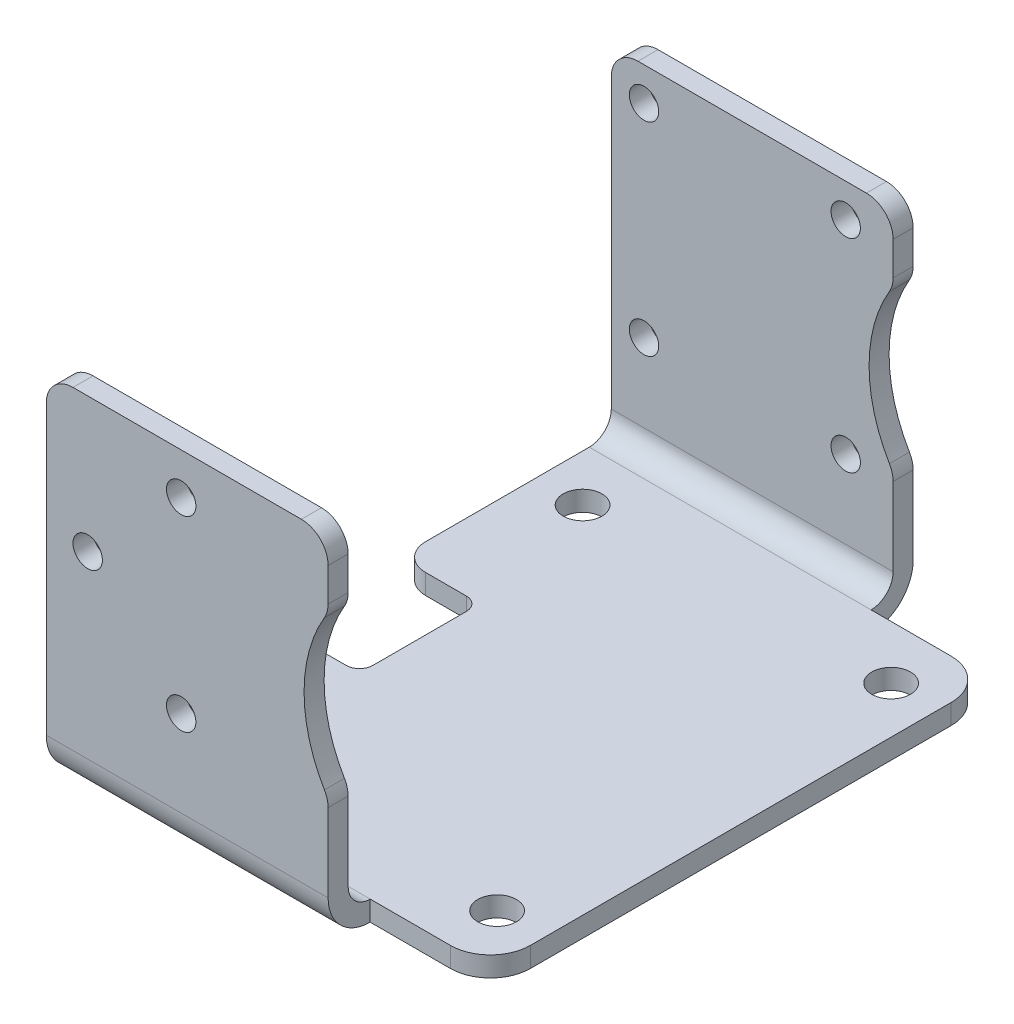
from build123d import *

# Parameters (mm, degrees)
SKETCH1_W                      = 40.1
SKETCH1_H                      = 40.8
BASE_FLANGE1_DEPTH             = 1.5
EDGE_FLANGE2_STRIP_W           = 9.3
EDGE_FLANGE2_STRIP_H           = 1.5
EDGE_FLANGE2_STRIP_CUT_DEPTH   = 40.1
EDGE_FLANGE2_STRIP_2_W         = 9.3
EDGE_FLANGE2_STRIP_2_H         = 1.5
EDGE_FLANGE2_STRIP_CUT_2_DEPTH = 40.1
EDGE_FLANGE2_DEPTH             = 40.1
EDGE_FLANGE2_BEND_DEPTH        = 40.1
SKETCH23_W                     = 3.15
SKETCH23_H                     = 26.7
CUT_EXTRUDE3_DEPTH             = 19
SKETCH24_R                     = 11
CUT_EXTRUDE4_DEPTH             = 55.364349532
SKETCH26_W                     = 10
SKETCH26_H                     = 37.5
CUT_EXTRUDE5_DEPTH             = 39.944222935
SKETCH27_R                     = 1.45
CUT_EXTRUDE6_DEPTH             = 39.944222935
FILLET1_R                      = 3
FILLET2_R                      = 2
F_2_0MM_DOWEL_HOLE1_D          = 2.2
F_2_0MM_DOWEL_HOLE1_DEPTH      = 1.5
F_2_0MM_DOWEL_HOLE2_D          = 2.2
F_2_0MM_DOWEL_HOLE2_DEPTH      = 1.5
CUT_EXTRUDE7_DEPTH             = 40.93122212
FILLET3_R                      = 2


# Sheet-metal steps are written as plain solids
with BuildPart() as part:
    # Sketch1 → Base-Flange1 (new body)
    with BuildSketch(Plane(origin=(0, 0, 0), x_dir=(1, 0, 0), z_dir=(0, 1, 0))):
        Rectangle(SKETCH1_W, SKETCH1_H)
    extrude(amount=-BASE_FLANGE1_DEPTH)

    # Edge-Flange2 strip (across the edge) → Edge-Flange2 strip cut (cut)
    with BuildSketch(Plane(origin=(-20.05, 0, 20.4), x_dir=(0, 0, -1), z_dir=(1, 0, 0))):
        with Locations((-3, -0.75)):
            Rectangle(EDGE_FLANGE2_STRIP_W, EDGE_FLANGE2_STRIP_H)
    extrude(amount=EDGE_FLANGE2_STRIP_CUT_DEPTH, mode=Mode.SUBTRACT)

    # Edge-Flange2 strip 2 (across the edge) → Edge-Flange2 strip cut 2 (cut)
    with BuildSketch(Plane(origin=(20.05, 0, -20.4), x_dir=(0, 0, 1), z_dir=(-1, 0, 0))):
        with Locations((-3, -0.75)):
            Rectangle(EDGE_FLANGE2_STRIP_2_W, EDGE_FLANGE2_STRIP_2_H)
    extrude(amount=EDGE_FLANGE2_STRIP_CUT_2_DEPTH, mode=Mode.SUBTRACT)

    # Edge-Flange2 section (across the edge) → Edge-Flange2 (add)
    with BuildSketch(Plane(origin=(-20.05, 0, 20.4), x_dir=(0, 0, -1), z_dir=(1, 0, 0))):
        with BuildLine():
            Line((-1.5, 1.65), (-1.5, 25.2))
            Line((-1.5, 25.2), (0, 25.2))
            Line((0, 25.2), (0, 1.65))
            ThreePointArc((0, 1.65), (0.483273811, 0.483273811), (1.65, 0))
            Line((1.65, 0), (1.65, -1.5))
            ThreePointArc((1.65, -1.5), (-0.577386361, -0.577386361), (-1.5, 1.65))
        make_face()
    extrude(amount=EDGE_FLANGE2_DEPTH)

    # Edge-Flange2 section 2 (across the edge) → Edge-Flange2 bend (add)
    with BuildSketch(Plane(origin=(20.05, 0, -20.4), x_dir=(0, 0, 1), z_dir=(-1, 0, 0))):
        with BuildLine():
            Line((-1.5, 1.65), (-1.5, 25.2))
            Line((-1.5, 25.2), (0, 25.2))
            Line((0, 25.2), (0, 1.65))
            ThreePointArc((0, 1.65), (0.483273811, 0.483273811), (1.65, 0))
            Line((1.65, 0), (1.65, -1.5))
            ThreePointArc((1.65, -1.5), (-0.577386361, -0.577386361), (-1.5, 1.65))
        make_face()
    extrude(amount=EDGE_FLANGE2_BEND_DEPTH)

    # Sketch23 → Cut-Extrude3 (cut)
    with BuildSketch(Plane(origin=(20.05, 0, 0), x_dir=(0, 0, -1), z_dir=(1, 0, 0))):
        with Locations((-20.325, 11.85)):
            Rectangle(SKETCH23_W, SKETCH23_H)
        with Locations((20.325, 11.85)):
            Rectangle(SKETCH23_W, SKETCH23_H)
    extrude(amount=-CUT_EXTRUDE3_DEPTH, mode=Mode.SUBTRACT)

    # Sketch24 → Cut-Extrude4 (cut, through all)
    with BuildSketch(Plane(origin=(0, 0, -21.9), x_dir=(-1, 0, 0), z_dir=(0, 0, -1))):
        with Locations((-10.25, 14.1)):
            Circle(SKETCH24_R)
    extrude(amount=-CUT_EXTRUDE4_DEPTH, mode=Mode.SUBTRACT)

    # Sketch26 → Cut-Extrude5 (cut, through all)
    with BuildSketch(Plane(origin=(0, 0, 0), x_dir=(1, 0, 0), z_dir=(0, 1, 0))):
        with Locations((15.05, 0)):
            Rectangle(SKETCH26_W, SKETCH26_H)
    extrude(amount=-CUT_EXTRUDE5_DEPTH, mode=Mode.SUBTRACT)

    # Sketch27 → Cut-Extrude6 (cut, through all)
    with BuildSketch(Plane(origin=(0, 0, 0), x_dir=(1, 0, 0), z_dir=(0, 1, 0))):
        with Locations(Location((-16.55, 14.75, 0), (0, 0, 270))):
            Circle(SKETCH27_R)
        with Locations(Location((6.55, 14.75, 0), (0, 0, 270))):
            Circle(SKETCH27_R)
        with Locations(Location((6.55, -14.75, 0), (0, 0, 270))):
            Circle(SKETCH27_R)
        with Locations(Location((-16.55, -14.75, 0), (0, 0, 270))):
            Circle(SKETCH27_R)
    extrude(amount=-CUT_EXTRUDE6_DEPTH, mode=Mode.SUBTRACT)

    # Fillet1
    fillet1_edges = [part.edges().sort_by_distance(p)[0] for p in [
        (10.05, -0.75, 18.75),
        (10.05, -0.75, -18.75),
    ]]
    fillet(fillet1_edges, radius=FILLET1_R)

    # Fillet2
    fillet2_edges = [part.edges().sort_by_distance(p)[0] for p in [
        (1.05, 25.2, -21.15),
        (1.05, 20.129925373, 21.15),
        (1.05, 8.070074627, 21.15),
        (1.05, 20.129925373, -21.15),
        (1.05, 8.070074627, -21.15),
        (-20.05, 25.2, 21.15),
        (-20.05, 25.2, -21.15),
        (1.05, 25.2, 21.15),
    ]]
    fillet(fillet2_edges, radius=FILLET2_R)

    # Ø2.0mm Dowel Hole1
    with Locations(Plane(origin=(0, 0, -21.9), x_dir=(-1, 0, 0), z_dir=(0, 0, -1))):
        with Locations((2.5, 22.7), (17.6, 22.7), (2.5, 7.5), (17.6, 7.5)):
            Hole(F_2_0MM_DOWEL_HOLE1_D / 2, depth=F_2_0MM_DOWEL_HOLE1_DEPTH)

    # Ø2.0mm Dowel Hole2
    with Locations(Plane.XY.offset(21.9)):
        with Locations((-16.95, 15.1), (-9.95, 22.1), (-9.95, 8.1)):
            Hole(F_2_0MM_DOWEL_HOLE2_D / 2, depth=F_2_0MM_DOWEL_HOLE2_DEPTH)

    # Sketch32 → Cut-Extrude7 (cut, through all)
    with BuildSketch(Plane.XZ.offset(1.5)):
        with BuildLine():
            Line((-20.05, 4.5), (-20.05, -4.5))
            Line((-20.05, -4.5), (-15, -4.5))
            ThreePointArc((-15, -4.5), (-14.292893219, -4.207106781), (-14, -3.5))
            Line((-14, -3.5), (-14, 3.5))
            ThreePointArc((-14, 3.5), (-14.292893219, 4.207106781), (-15, 4.5))
            Line((-15, 4.5), (-20.05, 4.5))
        make_face()
    extrude(amount=-CUT_EXTRUDE7_DEPTH, mode=Mode.SUBTRACT)

    # Fillet3
    fillet3_edges = [part.edges().sort_by_distance(p)[0] for p in [
        (-20.05, -0.75, -4.5),
        (-20.05, -0.75, 4.5),
    ]]
    fillet(fillet3_edges, radius=FILLET3_R)


solid = part.part
